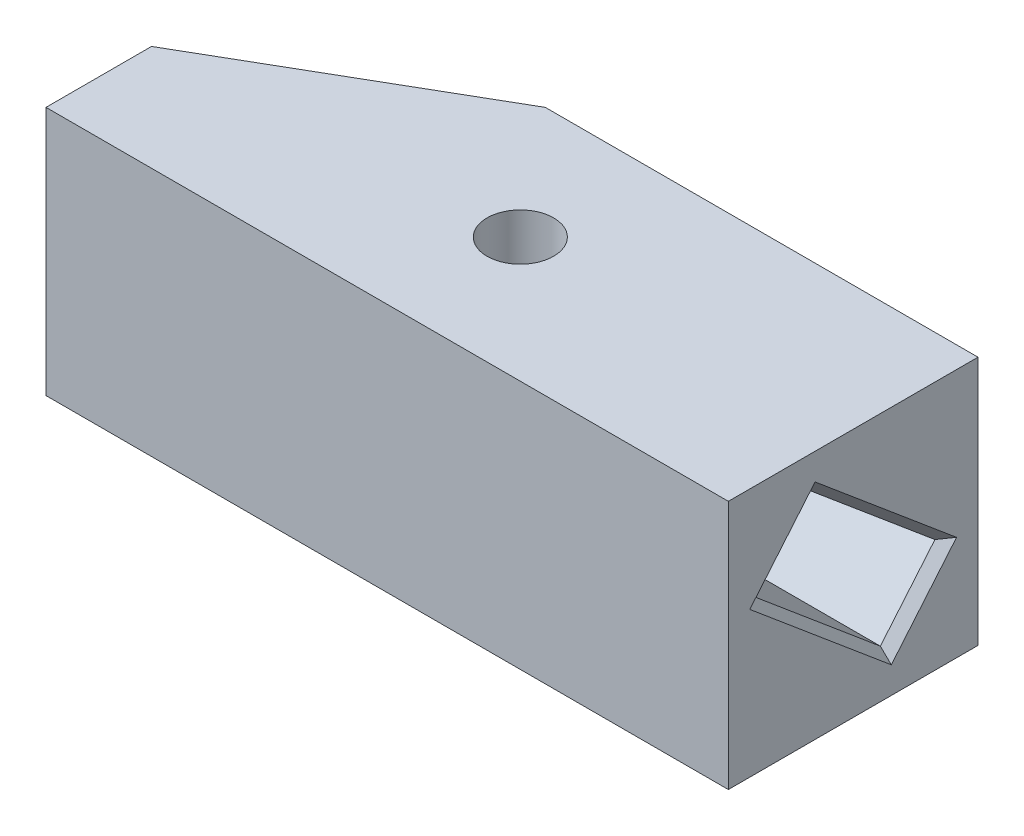
from build123d import *

# Parameters (mm, degrees)
EXTRUDE_1_DEPTH     = 30
SKETCH_2_R          = 4
CUT_EXTRUDE_1_DEPTH = 49.476798574
CUT_EXTRUDE_4_DEPTH = 25
SKETCH1_W           = 30
SKETCH1_H           = 30
BOSS_EXTRUDE1_DEPTH = 27
CHAMFER1_SIZE       = 30
CHAMFER1_SIZE2      = 17.320508076
CHAMFER2_SIZE       = 1
CHAMFER2_SIZE2      = 1.191753593


with BuildPart() as part:
    # Эскиз1 → Бобышка-Вытянуть1 (new body)
    with BuildSketch(Plane(origin=(0, 0, 0), x_dir=(1, 0, 0), z_dir=(0, 1, 0))):
        Polygon((-20, -15), (-35, -15), (-35, 15), (-20, 15), (20, 15), (20, -15), align=None)
    extrude(amount=EXTRUDE_1_DEPTH)

    # Эскиз2 → Вырез-Вытянуть1 (cut, through all)
    with BuildSketch(Plane(origin=(0, 30, 0), x_dir=(1, 0, 0), z_dir=(0, 1, 0))):
        with Locations((-20, 0)):
            Circle(SKETCH_2_R)
    extrude(amount=-CUT_EXTRUDE_1_DEPTH, mode=Mode.SUBTRACT)

    # Эскиз5 → Вырез-Вытянуть4 (cut)
    with BuildSketch(Plane(origin=(20, 0, 0), x_dir=(0, 0, -1), z_dir=(1, 0, 0))):
        Polygon((4.458832066, 4.601018482), (11.015265685, 12.414671802), (-4.458832066, 25.398981518), (-11.015265685, 17.585328198), align=None)
    extrude(amount=-CUT_EXTRUDE_4_DEPTH, mode=Mode.SUBTRACT)

    # Sketch1 → Boss-Extrude1 (add)
    with BuildSketch(Plane.ZY.offset(35)):
        with Locations((0, 15)):
            Rectangle(SKETCH1_W, SKETCH1_H)
    extrude(amount=BOSS_EXTRUDE1_DEPTH)

    # Chamfer1
    chamfer1_edges = [part.edges().sort_by_distance(p)[0] for p in [
        (-62, 15, -15),
    ]]
    chamfer1_side = [part.faces().sort_by_distance(p)[0] for p in [
        (-21, 15, -15),
    ]]
    chamfer(chamfer1_edges, length=CHAMFER1_SIZE, length2=CHAMFER1_SIZE2, reference=chamfer1_side[0])

    # Chamfer2
    chamfer2_edges = [part.edges().sort_by_distance(p)[0] for p in [
        (20, 8.507845142, -7.737048876),
        (20, 18.90682666, -3.278216809),
        (20, 21.492154858, 7.737048876),
        (20, 11.09317334, 3.278216809),
    ]]
    chamfer2_side = [part.faces().sort_by_distance(p)[0] for p in [
        (20, 15, -14.575735931),
    ]]
    chamfer(chamfer2_edges, length=CHAMFER2_SIZE, length2=CHAMFER2_SIZE2, reference=chamfer2_side[0])


solid = part.part
